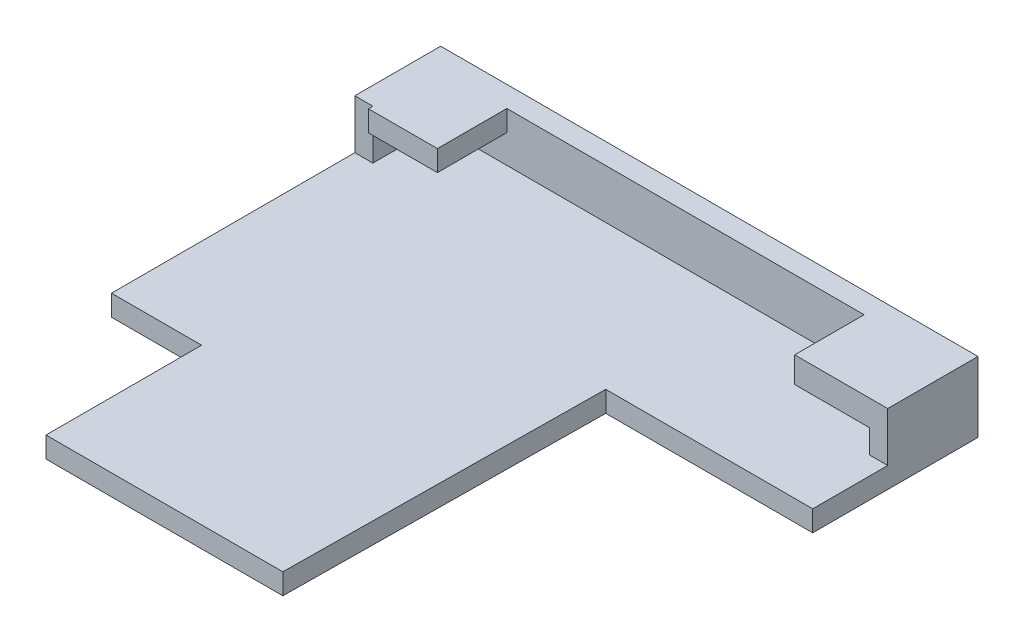
from build123d import *

# Parameters (mm, degrees)
BOSS_EXTRUDE1_DEPTH = 1.5
SKETCH2_W           = 35.686807758
SKETCH2_H           = 1.5
BOSS_EXTRUDE2_DEPTH = 1.5
SKETCH3_W           = 11.9
SKETCH3_H           = 1.5
BOSS_EXTRUDE3_DEPTH = 1.5
SKETCH4_W           = 23.7
SKETCH4_H           = 1.5
BOSS_EXTRUDE4_DEPTH = 1.5
BOSS_EXTRUDE5_DEPTH = 3.55
SKETCH6_W           = 4.966668371
SKETCH6_H           = 1.5
SKETCH6_W_2         = 5.4
SKETCH6_H_2         = 1.85
BOSS_EXTRUDE6_DEPTH = 5
SKETCH7_W           = 25.720139387
SKETCH7_H           = 1.5
BOSS_EXTRUDE7_DEPTH = 3.55


with BuildPart() as part:
    # Sketch1 → Boss-Extrude1 (new body)
    with BuildSketch(Plane(origin=(0, 0, 0), x_dir=(1, 0, 0), z_dir=(0, 1, 0))):
        Polygon((-75.339050621, 34.683913692), (-39.639050621, 34.683913692), (-39.639050621, 24.283913692), (-53.039050621, 24.283913692), (-53.289050621, 1.283913692), (-70.339050621, 1.283913692), (-70.339050621, 12.483913692), (-75.339050621, 12.483913692), (-75.339050621, 24.283913692), align=None)
    extrude(amount=BOSS_EXTRUDE1_DEPTH)

    # Sketch2 → Boss-Extrude2 (add)
    with BuildSketch(Plane(origin=(0, 0, -34.683913692), x_dir=(-1, 0, 0), z_dir=(0, 0, -1))):
        with Locations((57.4824545, 0.75)):
            Rectangle(SKETCH2_W, SKETCH2_H)
    extrude(amount=BOSS_EXTRUDE2_DEPTH)

    # Sketch3 → Boss-Extrude3 (add)
    with BuildSketch(Plane(origin=(-39.639050621, 0, 0), x_dir=(0, 0, -1), z_dir=(1, 0, 0))):
        with Locations((30.233913692, 0.75)):
            Rectangle(SKETCH3_W, SKETCH3_H)
    extrude(amount=BOSS_EXTRUDE3_DEPTH)

    # Sketch4 → Boss-Extrude4 (add)
    with BuildSketch(Plane.ZY.offset(75.325858379)):
        with Locations((-24.333913692, 0.75)):
            Rectangle(SKETCH4_W, SKETCH4_H)
    extrude(amount=BOSS_EXTRUDE4_DEPTH)

    # Sketch5 → Boss-Extrude5 (add)
    with BuildSketch(Plane(origin=(0, 1.5, 0), x_dir=(1, 0, 0), z_dir=(0, 1, 0))):
        Polygon((-75.525858379, 34.683913692), (-75.525858379, 30.004194868), (-76.825858379, 30.004194868), (-76.825858379, 36.183913692), (-70.559190008, 36.183913692), (-70.559190008, 34.683913692), align=None)
        Polygon((-39.439050621, 34.683913692), (-39.439050621, 29.683913692), (-38.139050621, 29.683913692), (-38.139050621, 36.183913692), (-44.839050621, 36.183913692), (-44.839050621, 34.683913692), align=None)
    extrude(amount=BOSS_EXTRUDE5_DEPTH)

    # Sketch6 → Boss-Extrude6 (add)
    with BuildSketch(Plane.XY.offset(-34.683913692)):
        with Locations((-73.042524194, 4.3)):
            Rectangle(SKETCH6_W, SKETCH6_H)
        with Locations((-42.139050621, 4.125)):
            Rectangle(SKETCH6_W_2, SKETCH6_H_2)
    extrude(amount=BOSS_EXTRUDE6_DEPTH)

    # Sketch7 → Boss-Extrude7 (add)
    with BuildSketch(Plane(origin=(0, 1.5, 0), x_dir=(1, 0, 0), z_dir=(0, 1, 0))):
        with Locations((-57.699120315, 35.433913692)):
            Rectangle(SKETCH7_W, SKETCH7_H)
    extrude(amount=BOSS_EXTRUDE7_DEPTH)


solid = part.part
